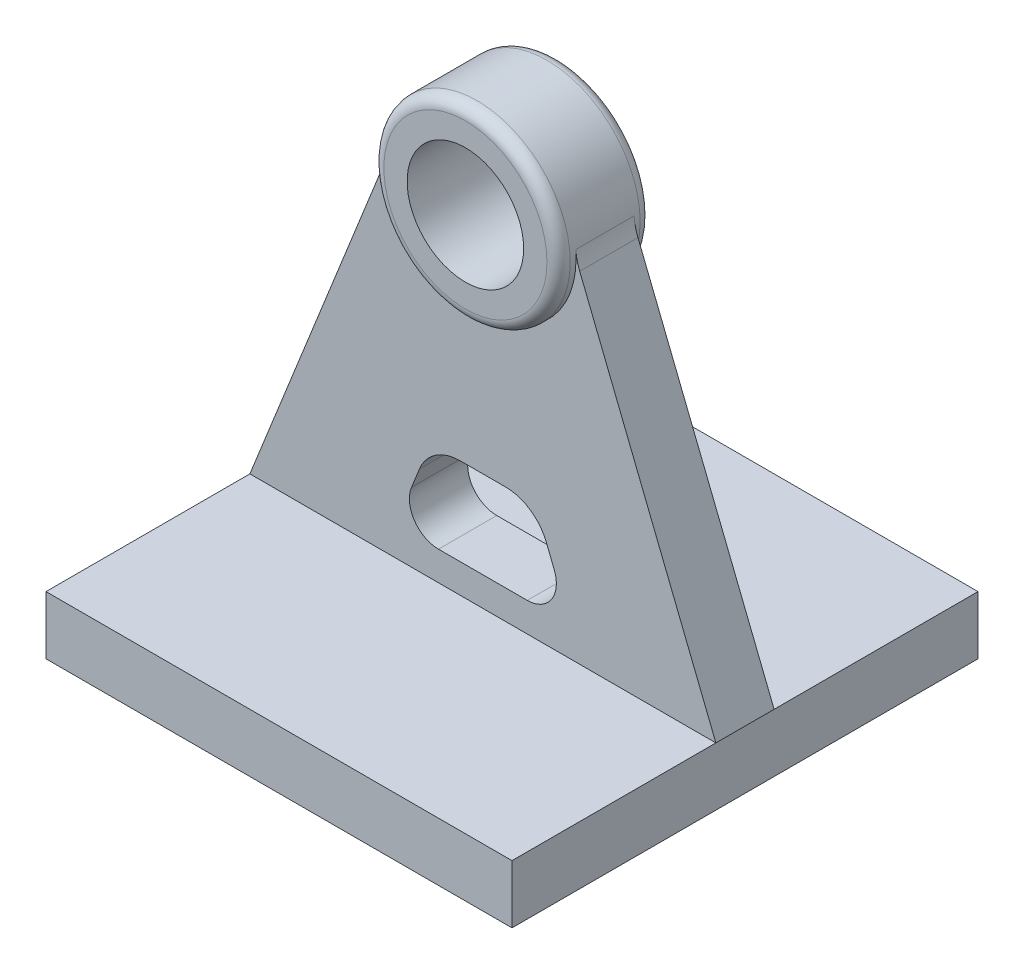
from build123d import *

# Parameters (mm, degrees)
SKETCH1_W           = 50.8
SKETCH1_H           = 50.8
BOSS_EXTRUDE1_DEPTH = 6.35
SKETCH2_R           = 10.16
SKETCH2_R_2         = 6.35
BOSS_EXTRUDE2_DEPTH = 5.08
BOSS_EXTRUDE3_DEPTH = 3.175
FILLET3_R           = 6.35
CUT_EXTRUDE1_DEPTH  = 6.35


with BuildPart() as part:
    # Sketch1 → Boss-Extrude1 (new body)
    with BuildSketch(Plane(origin=(0, 0, 0), x_dir=(1, 0, 0), z_dir=(0, 1, 0))):
        Rectangle(SKETCH1_W, SKETCH1_H)
    extrude(amount=BOSS_EXTRUDE1_DEPTH)



with BuildPart() as body_2:
    # Sketch2 → Boss-Extrude2 (new, symmetric)
    with BuildSketch(Plane.XY):
        with Locations((0, 44.45)):
            Circle(SKETCH2_R)
        with Locations((0, 44.45)):
            Circle(SKETCH2_R_2, mode=Mode.SUBTRACT)
    extrude(amount=BOSS_EXTRUDE2_DEPTH, both=True)


with BuildPart() as part_1:
    add(part.part)

    add(body_2.part)  # Boss-Extrude3 merges body 2
    # Sketch4 → Boss-Extrude3 (add, symmetric)
    with BuildSketch(Plane.XY):
        with BuildLine():
            Line((-10.16, 44.45), (-25.4, 6.35))
            Line((-25.4, 6.35), (25.4, 6.35))
            Line((25.4, 6.35), (10.16, 44.45))
            ThreePointArc((10.16, 44.45), (0, 34.29), (-10.16, 44.45))
        make_face()
    extrude(amount=BOSS_EXTRUDE3_DEPTH, both=True)

    # Fillet2: read off the stored shape, not the designer's step
    # Fillet2 outline → Fillet2 (revolve, cut)
    with BuildSketch(Plane.XZ.offset(-44.45)):
        with BuildLine():
            ThreePointArc((10.16, -3.81), (9.788025612, -4.708025612), (8.89, -5.08))
            Line((8.89, -5.08), (10.16, -5.08))
            Line((10.16, -5.08), (10.16, -3.81))
        make_face()
        with BuildLine():
            ThreePointArc((8.89, 5.08), (9.788025612, 4.708025612), (10.16, 3.81))
            Line((10.16, 3.81), (10.16, 5.08))
            Line((10.16, 5.08), (8.89, 5.08))
        make_face()
    revolve(axis=Axis((0, 44.45, 0), (0, 0, 1)), mode=Mode.SUBTRACT)

    # Fillet3
    # the kernel refuses this fillet: 6.35 mm, written as the material it adds along each edge
    with BuildSketch(Plane(origin=(10.16, 44.45, 3.175), x_dir=(-0.041343675933645734, 0.9991449847045691, 0), z_dir=(0, 0, -1))) as fillet3_piece_1:
        with BuildLine():
            CenterArc((1.102635837, 6.344570653), FILLET3_R, 250.56808401, 17.062422493)
            Line((-1.009923388, 0.356282624), (0, 0))
            ThreePointArc((0, 0), (0.420051747, 0.008686955), (0.840103495, 0))
        make_face()
    extrude(amount=6.35)
    with BuildSketch(Plane(origin=(-10.16, 44.45, 3.175), x_dir=(0.04134367593364538, 0.9991449847045691, 0), z_dir=(0, 0, -1))) as fillet3_piece_2:
        with BuildLine():
            CenterArc((1.102635837, -6.344570653), FILLET3_R, 92.369493497, 17.062422493)
            Line((-1.009923388, -0.356282624), (0, 0))
            ThreePointArc((0, 0), (0.420051747, -0.008686955), (0.840103495, 0))
        make_face()
    extrude(amount=6.35)

    # Sketch6 → Cut-Extrude1 (cut)
    with BuildSketch(Plane.XY.offset(3.175)):
        with BuildLine():
            Line((-2.490630521, 19.05), (2.490630521, 19.05))
            ThreePointArc((2.490630521, 19.05), (5.160625226, 18.231170185), (6.912500762, 16.056248096))
            Line((6.912500762, 16.056248096), (7.783333841, 13.879165397))
            ThreePointArc((7.783333841, 13.879165397), (7.464533804, 10.92000353), (4.835420347, 9.525))
            Line((4.835420347, 9.525), (-4.835420347, 9.525))
            ThreePointArc((-4.835420347, 9.525), (-7.464533804, 10.92000353), (-7.783333841, 13.879165397))
            Line((-7.783333841, 13.879165397), (-6.912500762, 16.056248096))
            ThreePointArc((-6.912500762, 16.056248096), (-5.160625226, 18.231170185), (-2.490630521, 19.05))
        make_face()
    extrude(amount=-CUT_EXTRUDE1_DEPTH, mode=Mode.SUBTRACT)


solid = part_1.part
